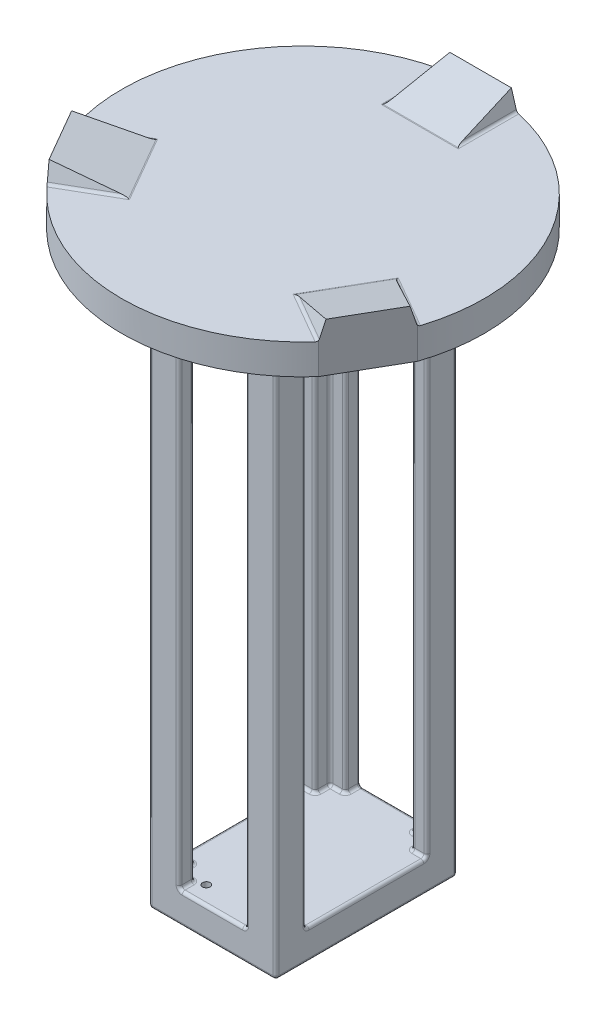
from build123d import *

# Parameters (mm, degrees)
BOSS_EXTRU_1_DEPTH                 = 5
BOSS_EXTRU_2_DEPTH                 = 180
ESQUISSE7_W                        = 41.99999999999998
ESQUISSE7_H                        = 59.999999999999986
BOSS_EXTRU_3_DEPTH                 = 10
CONG_3_R                           = 1
ENL_V_MAT_EXTRU_4_REACH            = 219.256
ESQUISSE8_R                        = 1.2499999999999996
BOSS_EXTRU_4_DEPTH                 = 20
ENL_V_MAT_EXTRU_5_DEPTH            = 213.66170318136744
CONG_9_R                           = 1
R_P_TITION_CIRCULAIRE2_COUNT       = 3
CONG_9_OF_R_P_TITION_CIRCULAIRE2_R = 1


with BuildPart() as part:
    # Esquisse1 → Boss.-Extru.1 (new, symmetric)
    with BuildSketch(Plane(origin=(0, 0, 0), x_dir=(1, 0, 0), z_dir=(0, 1, 0))):
        with BuildLine():
            Line((-11.999999999999618, 58.78775382679627), (11.999999999999956, 58.78775382679629))
            ThreePointArc((11.999999999999956, 58.78775382679629), (51.96152422706637, 29.999999999999925), (56.911688245431634, -19.001572067985176))
            Line((56.911688245431634, -19.001572067985176), (44.911688245431876, -39.786181758811345))
            ThreePointArc((44.911688245431876, -39.786181758811345), (1.9019e-13, -60), (-44.9116882454314, -39.78618175881143))
            Line((-44.9116882454314, -39.78618175881143), (-56.9116882454312, -19.00157206798526))
            ThreePointArc((-56.9116882454312, -19.00157206798526), (-51.96152422706627, 29.999999999999936), (-11.999999999999618, 58.78775382679627))
        make_face()
    extrude(amount=BOSS_EXTRU_1_DEPTH, both=True)

    # Esquisse3 → Boss.-Extru.2 (add)
    with BuildSketch(Plane.XZ.offset(5)):
        Polygon((21.000000000000004, 30), (11.000000000000004, 30), (11.000000000000004, 25.000000000000004), (16, 25.000000000000004), (16, 20.000000000000004), (20.999999999999996, 20.000000000000004), align=None)
        Polygon((21.000000000000004, -20.000000000000004), (16, -20), (16, -25.000000000000004), (11.000000000000004, -25.000000000000004), (11.000000000000004, -30.000000000000004), (21.000000000000004, -30), align=None)
        Polygon((-20.999999999999993, -30.000000000000007), (-20.999999999999993, -20.000000000000004), (-15.999999999999993, -20.000000000000004), (-15.999999999999993, -25.000000000000004), (-10.999999999999993, -25.000000000000004), (-10.999999999999993, -30.000000000000007), align=None)
        Polygon((-20.999999999999993, 29.999999999999993), (-20.999999999999993, 20.000000000000004), (-15.999999999999993, 20.000000000000004), (-16, 25), (-10.999999999999996, 24.999999999999996), (-10.999999999999996, 29.999999999999993), align=None)
    extrude(amount=BOSS_EXTRU_2_DEPTH)

    # Esquisse7 → Boss.-Extru.3 (add)
    with BuildSketch(Plane.XZ.offset(185)):
        Rectangle(ESQUISSE7_W, ESQUISSE7_H)
    extrude(amount=BOSS_EXTRU_3_DEPTH)

    # Congé3
    cong_3_edges = [part.edges().sort_by_distance(p)[0] for p in [
        (-18.499999999999993, -185, 20.000000000000004),
        (-18.499999999999993, -5, 20.000000000000004),
        (-15.999999999999993, -95, 20.000000000000004),
        (-15.999999999999996, -185, 22.5),
        (-15.999999999999996, -5, 22.5),
        (-16, -95, 25),
        (-13.499999999999998, -185, 25),
        (-13.499999999999998, -5, 25),
        (-10.999999999999996, -95, 24.999999999999996),
        (-10.999999999999996, -185, 27.499999999999993),
        (-10.999999999999996, -5, 27.499999999999993),
        (18.5, -185, -20.000000000000004),
        (18.5, -5, -20.000000000000004),
        (16, -95, -20),
        (16, -185, -22.5),
        (16, -5, -22.5),
        (16, -95, -25.000000000000004),
        (13.500000000000002, -185, -25.000000000000004),
        (13.500000000000002, -5, -25.000000000000004),
        (11.000000000000004, -95, -25.000000000000004),
        (11.000000000000004, -185, -27.500000000000004),
        (11.000000000000004, -5, -27.500000000000004),
        (11.000000000000004, -185, 27.5),
        (11.000000000000004, -5, 27.5),
        (11.000000000000004, -95, 25.000000000000004),
        (13.500000000000002, -185, 25.000000000000004),
        (13.500000000000002, -5, 25.000000000000004),
        (16, -95, 25.000000000000004),
        (16, -185, 22.500000000000004),
        (16, -5, 22.500000000000004),
        (16, -95, 20.000000000000004),
        (18.5, -185, 20.000000000000004),
        (18.5, -5, 20.000000000000004),
        (-10.999999999999993, -185, -27.500000000000007),
        (-10.999999999999993, -5, -27.500000000000007),
        (-10.999999999999993, -95, -25.000000000000004),
        (-13.499999999999993, -185, -25.000000000000004),
        (-13.499999999999993, -5, -25.000000000000004),
        (-15.999999999999993, -95, -25.000000000000004),
        (-15.999999999999993, -185, -22.500000000000004),
        (-15.999999999999993, -5, -22.500000000000004),
        (-15.999999999999993, -95, -20.000000000000004),
        (-18.499999999999993, -185, -20.000000000000004),
        (-18.499999999999993, -5, -20.000000000000004),
        (21, -5, 25),
        (20.999999999999996, -95, 20.000000000000004),
        (21.000000000000004, -95, -20.000000000000004),
        (21.000000000000004, -5, -25),
        (11.000000000000004, -95, -30.000000000000004),
        (-10.999999999999993, -95, -30.000000000000007),
        (-15.999999999999993, -5, -30.000000000000007),
        (20.999999999999996, -100, -29.999999999999996),
        (16.000000000000004, -5, -30),
        (-20.999999999999993, -100, -30),
        (-20.999999999999993, -5, -25.000000000000007),
        (-20.999999999999993, -95, -20.000000000000004),
        (-20.999999999999993, -95, 20.000000000000004),
        (-20.999999999999993, -5, 25),
        (-10.999999999999996, -95, 29.999999999999993),
        (11.000000000000004, -95, 30),
        (16.000000000000004, -5, 30),
        (20.999999999999996, -100, 29.999999999999996),
        (-20.999999999999993, -100, 29.999999999999993),
        (-15.999999999999995, -5, 29.999999999999993),
        (20.99999999999999, -195, 0),
        (20.99999999999999, -185, -3.55e-15),
        (3.55e-15, -185, -29.999999999999993),
        (0, -195, -29.999999999999993),
        (-20.99999999999999, -195, 0),
        (-20.99999999999999, -185, 3.55e-15),
        (3.55e-15, -185, 29.999999999999993),
        (0, -195, 29.999999999999993),
    ]]
    fillet(cong_3_edges, radius=CONG_3_R)

    # Esquisse8 → Enlèv. mat.-Extru.4 (cut, up to next)
    with BuildSketch(Plane.XZ.offset(195), mode=Mode.PRIVATE) as enl_v_mat_extru_4_sk1:
        with Locations((8, 24.000000000000004)):
            Circle(ESQUISSE8_R)
    enl_v_mat_extru_4_tool1 = extrude(enl_v_mat_extru_4_sk1.sketch, amount=-ENL_V_MAT_EXTRU_4_REACH, mode=Mode.PRIVATE) & part.part
    # Esquisse8 → Enlèv. mat.-Extru.4 (cut, up to next)
    with BuildSketch(Plane.XZ.offset(195), mode=Mode.PRIVATE) as enl_v_mat_extru_4_sk2:
        with Locations((-8, 24.000000000000004)):
            Circle(ESQUISSE8_R)
    enl_v_mat_extru_4_tool2 = extrude(enl_v_mat_extru_4_sk2.sketch, amount=-ENL_V_MAT_EXTRU_4_REACH, mode=Mode.PRIVATE) & part.part
    add(enl_v_mat_extru_4_tool1.solids().sort_by_distance((8, -195, 24))[0], mode=Mode.SUBTRACT)
    add(enl_v_mat_extru_4_tool2.solids().sort_by_distance((-8, -195, 24))[0], mode=Mode.SUBTRACT)

    # Esquisse13 → Boss.-Extru.4 (add)
    with BuildSketch(Plane(origin=(-5.099e-14, 0, -58.787753826796276), x_dir=(-1, 0, 8.7e-16), z_dir=(-8.7e-16, 0, -1))):
        Polygon((-10.185, 11.1347785), (10.185, 11.1347785), (11.999999999999568, 5), (-12.000000000000005, 5), align=None)
    boss_extru_4 = extrude(amount=-BOSS_EXTRU_4_DEPTH)

    # Esquisse15 → Enlèv. mat.-Extru.5 (cut, symmetric)
    with BuildSketch(Plane(origin=(0, 0, 0), x_dir=(0, 0, -1), z_dir=(1, 0, 0))):
        Polygon((38.78775382679629, 5), (58.78775382679628, 11.1347785), (38.787753826796276, 11.1347785), align=None)
    enl_v_mat_extru_5 = extrude(amount=ENL_V_MAT_EXTRU_5_DEPTH, both=True, mode=Mode.SUBTRACT)

    # Congé9
    cong_9_edges = [part.edges().sort_by_distance(p)[0] for p in [
        (11.999999999999963, 5, -48.78775382679628),
        (1.8485e-13, 5, -38.787753826796276),
        (-11.999999999999611, 5, -48.78775382679627),
    ]]
    fillet(cong_9_edges, radius=CONG_9_R)

    # Répétition circulaire2: Boss.-Extru.4, Enlèv. mat.-Extru.5 ×3 about axis
    r_p_tition_circulaire2_axis = Axis((0, 5, 0), (0, 1, 0))
    add([boss_extru_4.rotate(r_p_tition_circulaire2_axis, i * 360 / R_P_TITION_CIRCULAIRE2_COUNT) for i in range(1, R_P_TITION_CIRCULAIRE2_COUNT)])
    add([enl_v_mat_extru_5.rotate(r_p_tition_circulaire2_axis, i * 360 / R_P_TITION_CIRCULAIRE2_COUNT) for i in range(1, R_P_TITION_CIRCULAIRE2_COUNT)], mode=Mode.SUBTRACT)

    # Congé9 of Répétition circulaire2
    cong_9_of_r_p_tition_circulaire2_edges = [part.edges().sort_by_distance(p)[0] for p in [
        (-48.251434207587025, 5, 14.001572067984899),
        (-33.59118016974274, 5, 19.39387691339797),
        (-36.25143420758723, 5, 34.786181758811054),
        (36.251434207587046, 5, 34.786181758811395),
        (33.59118016974255, 5, 19.393876913398316),
        (48.251434207586826, 5, 14.001572067985233),
    ]]
    fillet(cong_9_of_r_p_tition_circulaire2_edges, radius=CONG_9_OF_R_P_TITION_CIRCULAIRE2_R)


solid = part.part
